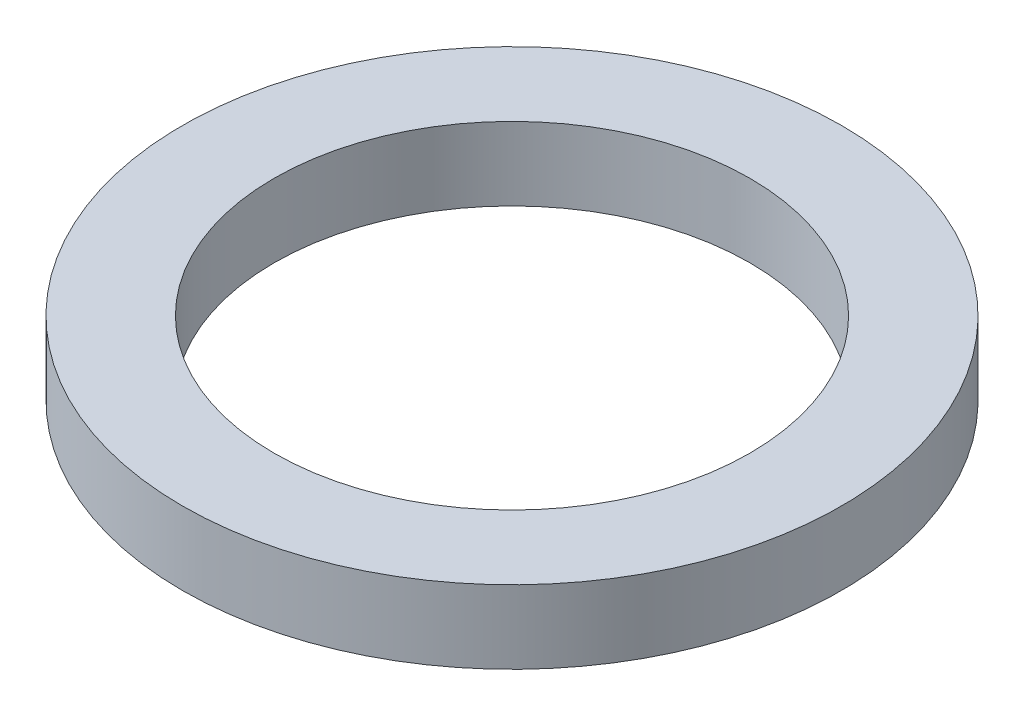
from build123d import *

# Parameters (mm, degrees)
SKETCH1_R           = 45
BOSS_EXTRUDE1_DEPTH = 10
SKETCH2_R           = 32.5
CUT_EXTRUDE1_DEPTH  = 65.420493634


with BuildPart() as part:
    # Sketch1 → Boss-Extrude1 (new body)
    with BuildSketch(Plane(origin=(0, 0, 0), x_dir=(1, 0, 0), z_dir=(0, 1, 0))):
        Circle(SKETCH1_R)
    extrude(amount=BOSS_EXTRUDE1_DEPTH)

    # Sketch2 → Cut-Extrude1 (cut, through all)
    with BuildSketch(Plane(origin=(0, 0, 0), x_dir=(1, 0, 0), z_dir=(0, 1, 0))):
        Circle(SKETCH2_R)
    extrude(amount=CUT_EXTRUDE1_DEPTH, mode=Mode.SUBTRACT)


solid = part.part
